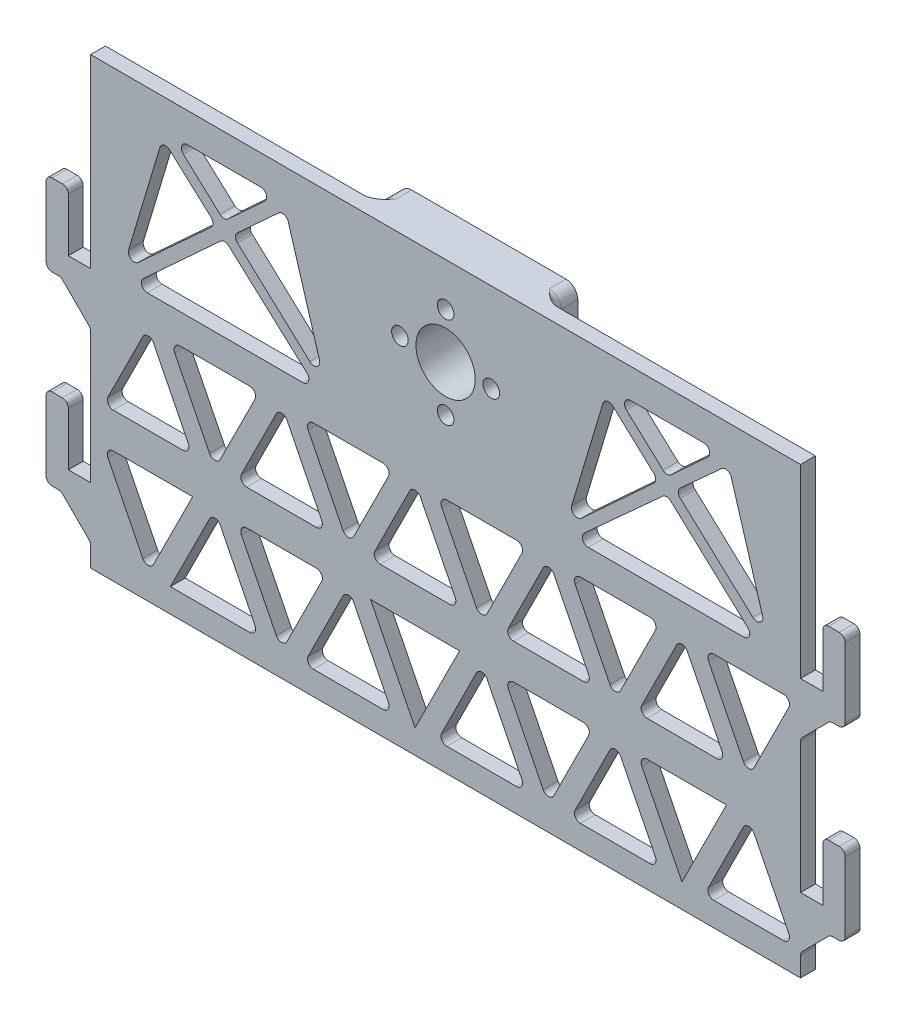
from build123d import *

# Parameters (mm, degrees)
SKETCH1_W            = 38.1
SKETCH1_H            = 38.1
BOSS_EXTRUDE1_DEPTH  = 9.2583
SKETCH2_R            = 6.35
CUT_EXTRUDE1_DEPTH   = 10.8458
SKETCH3_R            = 1.778
CUT_EXTRUDE2_DEPTH   = 10.8458
CIRPATTERN1_COUNT    = 4
SKETCH4_W            = 56.957976
SKETCH4_H            = 95.2246
BOSS_EXTRUDE2_DEPTH  = 3.175
SKETCH5_W            = 38.1
SKETCH5_H            = 57.1246
BOSS_EXTRUDE3_DEPTH  = 3.175
FILLET1_R            = 2.54
FILLET2_R            = 2.54
BOSS_EXTRUDE4_DEPTH  = 3.175
BOSS_EXTRUDE5_DEPTH  = 3.175
CHAMFER1_SIZE        = 6.35
FILLET3_R            = 1.27
CHAMFER2_SIZE        = 6.35
FILLET4_R            = 1.27
CUT_EXTRUDE3_DEPTH   = 4.7625
BOSS_EXTRUDE6_DEPTH  = 3.175
BOSS_EXTRUDE7_DEPTH  = 3.175
FILLET5_R            = 1.27
FILLET6_R            = 1.27
CUT_EXTRUDE4_DEPTH   = 3.175
LPATTERN1_COUNT      = 5
LPATTERN1_PITCH      = 28.575
MIRROR5_COPY_1_DEPTH = 3.175
MIRROR5_COPY_2_DEPTH = 3.175
MIRROR5_COPY_3_DEPTH = 3.175
MIRROR5_COPY_4_DEPTH = 3.175
FILLET7_R            = 1.27


with BuildPart() as part:
    # Sketch1 → Boss-Extrude1 (new body)
    with BuildSketch(Plane.XY):
        with Locations((-19.05, -19.05)):
            Rectangle(SKETCH1_W, SKETCH1_H)
    extrude(amount=BOSS_EXTRUDE1_DEPTH)

    # Sketch2 → Cut-Extrude1 (cut)
    with BuildSketch(Plane.XY.offset(9.2583)):
        with Locations((-19.05, -19.05)):
            Circle(SKETCH2_R)
    extrude(amount=-CUT_EXTRUDE1_DEPTH, mode=Mode.SUBTRACT)

    # Sketch3 → Cut-Extrude2 (cut)
    with BuildSketch(Plane.XY.offset(9.2583)):
        with Locations((-19.05, -9.271)):
            Circle(SKETCH3_R)
    cut_extrude2 = extrude(amount=-CUT_EXTRUDE2_DEPTH, mode=Mode.SUBTRACT)

    # CirPattern1: Cut-Extrude2 ×4 about axis
    cirpattern1_axis = Axis((-19.05, -19.05, 0), (0, 0, 1))
    for i in range(1, CIRPATTERN1_COUNT):
        add(cut_extrude2.rotate(cirpattern1_axis, i * 360 / CIRPATTERN1_COUNT), mode=Mode.SUBTRACT)

    # Sketch4 → Boss-Extrude2 (add)
    with BuildSketch(Plane.XY.offset(9.2583)):
        with Locations((-66.578988, -47.6123)):
            Rectangle(SKETCH4_W, SKETCH4_H)
        with Locations((28.478988, -47.6123)):
            Rectangle(SKETCH4_W, SKETCH4_H)
    extrude(amount=-BOSS_EXTRUDE2_DEPTH)

    # Sketch5 → Boss-Extrude3 (add)
    with BuildSketch(Plane(origin=(0, 0, 6.0833), x_dir=(-1, 0, 0), z_dir=(0, 0, -1))):
        with Locations((19.05, -66.6623)):
            Rectangle(SKETCH5_W, SKETCH5_H)
    extrude(amount=-BOSS_EXTRUDE3_DEPTH)

    # Fillet1
    fillet1_edges = [part.edges().sort_by_distance(p)[0] for p in [
        (-38.1, -38.1, 3.04165),
        (-38.1, 0, 3.04165),
        (0, 0, 3.04165),
        (0, -38.1, 3.04165),
    ]]
    fillet(fillet1_edges, radius=FILLET1_R)

    # Fillet2
    # the kernel refuses this fillet: 2.54 mm, written as the material it adds along each edge
    with BuildSketch(Plane(origin=(-38.1, -35.56, 6.0833), x_dir=(0, 0, -1), z_dir=(0, 1, 0)), Plane(origin=(-2.54, -38.1, 6.0833), x_dir=(0, 0, -1), z_dir=(-1, 0, 0))) as fillet2_piece_1:
        with BuildLine():
            CenterArc((FILLET2_R, FILLET2_R), FILLET2_R, 180, 90)
            Line((0, FILLET2_R), (0, 0))
            Line((0, 0), (FILLET2_R, 0))
        make_face()
    extrude(amount=33.02)
    with BuildSketch(Plane(origin=(0, -35.56, 6.0833), x_dir=(0, 0, -1), z_dir=(0, 1, 0))) as fillet2_piece_2:
        with BuildLine():
            CenterArc((FILLET2_R, -FILLET2_R), FILLET2_R, 90, 90)
            Line((0, -FILLET2_R), (0, 0))
            Line((0, 0), (FILLET2_R, 0))
        make_face()
    extrude(amount=33.02)
    with BuildSketch(Plane(origin=(-35.56, -2.54, 6.0833), x_dir=(0.5976672776328278, -0.8017442392976482, 0), z_dir=(-0.8017442392976482, -0.5976672776328278, 0))) as fillet2_piece_3_section:
        with BuildLine():
            CenterArc((2.54 + FILLET2_R, -FILLET2_R), FILLET2_R, 90, 90)
            Line((2.54 + FILLET2_R, 0), (2.54, 0))
            Line((2.54, 0), (2.54, -FILLET2_R))
        make_face()
    fillet2_piece_3 = revolve(axis=Axis((-35.56, -2.54, 6.0833), (0, 0, 1)), revolution_arc=233.296989237, mode=Mode.PRIVATE)
    fillet2_piece_3 = split(fillet2_piece_3, bisect_by=Plane(origin=(-37.464844957, 0, 5.291764105), z_dir=(0, -1, 0)), keep=Keep.TOP, mode=Mode.PRIVATE)
    add(fillet2_piece_3)
    with BuildSketch(Plane(origin=(-35.56, -35.56, 6.0833), x_dir=(0, -1, 0), z_dir=(1, 0, 0))) as fillet2_piece_4:
        with BuildLine():
            CenterArc((2.54 + FILLET2_R, FILLET2_R), FILLET2_R, 180, 90)
            Line((2.54 + FILLET2_R, 0), (2.54, 0))
            Line((2.54, 0), (2.54, FILLET2_R))
        make_face()
    revolve(axis=Axis((-35.56, -35.56, 6.0833), (0, 0, -1)), revolution_arc=90)
    with BuildSketch(Plane(origin=(-2.54, -35.56, 6.0833), x_dir=(0, -1, 0), z_dir=(-1, 0, 0))) as fillet2_piece_5:
        with BuildLine():
            CenterArc((2.54 + FILLET2_R, -FILLET2_R), FILLET2_R, 90, 90)
            Line((2.54 + FILLET2_R, 0), (2.54, 0))
            Line((2.54, 0), (2.54, -FILLET2_R))
        make_face()
    revolve(axis=Axis((-2.54, -35.56, 6.0833), (0, 0, 1)), revolution_arc=90)
    with BuildSketch(Plane(origin=(-2.54, -2.54, 6.0833), x_dir=(-0.5976672776328269, -0.8017442392976487, 0), z_dir=(0.8017442392976487, -0.5976672776328269, 0))) as fillet2_piece_6_section:
        with BuildLine():
            CenterArc((2.54 + FILLET2_R, FILLET2_R), FILLET2_R, 180, 90)
            Line((2.54, FILLET2_R), (2.54, 0))
            Line((2.54, 0), (2.54 + FILLET2_R, 0))
        make_face()
    fillet2_piece_6 = revolve(axis=Axis((-2.54, -2.54, 6.0833), (0, 0, -1)), revolution_arc=233.296989237, mode=Mode.PRIVATE)
    fillet2_piece_6 = split(fillet2_piece_6, bisect_by=Plane(origin=(-0.63515521, 0, 5.291763812), z_dir=(0, -1, 0)), keep=Keep.TOP, mode=Mode.PRIVATE)
    add(fillet2_piece_6)

    # Sketch6 → Boss-Extrude4 (add)
    with BuildSketch(Plane(origin=(0, 0, 6.0833), x_dir=(-1, 0, 0), z_dir=(0, 0, -1))):
        Polygon((-56.957976, -39.6875), (-61.720476, -39.6875), (-61.720476, -26.9875), (-66.482976, -26.9875), (-66.482976, -44.45), (-56.957976, -44.45), align=None)
    boss_extrude4 = extrude(amount=-BOSS_EXTRUDE4_DEPTH)

    # Sketch7 → Boss-Extrude5 (add)
    with BuildSketch(Plane(origin=(0, 0, 6.0833), x_dir=(-1, 0, 0), z_dir=(0, 0, -1))):
        Polygon((-56.957976, -84.1375), (-66.482976, -84.1375), (-66.482976, -66.675), (-61.720476, -66.675), (-61.720476, -79.375), (-56.957976, -79.375), align=None)
    boss_extrude5 = extrude(amount=-BOSS_EXTRUDE5_DEPTH)

    # Chamfer1
    chamfer1_edges = [part.edges().sort_by_distance(p)[0] for p in [
        (56.957976, -44.45, 7.6708),
        (56.957976, -84.1375, 7.6708),
    ]]
    chamfer(chamfer1_edges, length=CHAMFER1_SIZE)

    # Fillet3
    fillet3_edges = [part.edges().sort_by_distance(p)[0] for p in [
        (66.482976, -44.45, 7.6708),
        (66.482976, -26.9875, 7.6708),
        (61.720476, -26.9875, 7.6708),
        (66.482976, -84.1375, 7.6708),
        (66.482976, -66.675, 7.6708),
        (61.720476, -66.675, 7.6708),
        (63.307976, -84.1375, 7.6708),
        (56.957976, -90.4875, 7.6708),
        (63.307976, -44.45, 7.6708),
        (56.957976, -50.8, 7.6708),
    ]]
    fillet(fillet3_edges, radius=FILLET3_R)

    # Mirror2: Boss-Extrude4, Boss-Extrude5 across plane
    add(boss_extrude4.mirror(Plane(origin=(-19.05, 0, 0), x_dir=(0, 0, 1), z_dir=(1, 0, 0))))
    add(boss_extrude5.mirror(Plane(origin=(-19.05, 0, 0), x_dir=(0, 0, 1), z_dir=(1, 0, 0))))

    # Chamfer2
    chamfer2_edges = [part.edges().sort_by_distance(p)[0] for p in [
        (-95.057976, -44.45, 7.6708),
        (-95.057976, -84.1375, 7.6708),
    ]]
    chamfer(chamfer2_edges, length=CHAMFER2_SIZE)

    # Fillet4
    fillet4_edges = [part.edges().sort_by_distance(p)[0] for p in [
        (-99.820476, -26.9875, 7.6708),
        (-104.582976, -26.9875, 7.6708),
        (-104.582976, -44.45, 7.6708),
        (-99.820476, -66.675, 7.6708),
        (-104.582976, -66.675, 7.6708),
        (-104.582976, -84.1375, 7.6708),
        (-95.057976, -50.8, 7.6708),
        (-101.407976, -44.45, 7.6708),
        (-95.057976, -90.4875, 7.6708),
        (-101.407976, -84.1375, 7.6708),
    ]]
    fillet(fillet4_edges, radius=FILLET4_R)

    # Sketch8 → Cut-Extrude3 (cut)
    with BuildSketch(Plane(origin=(0, 0, 6.0833), x_dir=(-1, 0, 0), z_dir=(0, 0, -1))):
        Polygon((-50.607976, -38.1), (-6.157976, -38.1), (-15.682976, -6.35), (-41.082976, -6.35), align=None)
    cut_extrude3 = extrude(amount=-CUT_EXTRUDE3_DEPTH, mode=Mode.SUBTRACT)

    # Mirror3: Cut-Extrude3 across plane
    add(cut_extrude3.mirror(Plane(origin=(-19.05, 0, 0), x_dir=(0, 0, 1), z_dir=(1, 0, 0))), mode=Mode.SUBTRACT)

    # Sketch9 → Boss-Extrude6 (add)
    with BuildSketch(Plane(origin=(0, 0, 6.0833), x_dir=(-1, 0, 0), z_dir=(0, 0, -1))):
        Polygon((-41.539140768, -7.870549228), (-8.189976, -38.1), (-6.157976, -38.1), (-6.614140768, -36.579450772), (-39.495476, -6.35), (-41.082976, -6.35), align=None)
    boss_extrude6 = extrude(amount=-BOSS_EXTRUDE6_DEPTH)

    # Sketch10 → Boss-Extrude7 (add)
    with BuildSketch(Plane(origin=(0, 0, 6.0833), x_dir=(-1, 0, 0), z_dir=(0, 0, -1))):
        Polygon((-50.607976, -38.1), (-48.067976, -38.1), (-15.226811232, -7.870549228), (-15.682976, -6.35), (-17.270476, -6.35), (-50.151811232, -36.579450772), align=None)
    boss_extrude7 = extrude(amount=-BOSS_EXTRUDE7_DEPTH)

    # Mirror4: Boss-Extrude6, Boss-Extrude7 across plane
    add(boss_extrude6.mirror(Plane(origin=(-19.05, 0, 0), x_dir=(0, 0, 1), z_dir=(1, 0, 0))))
    add(boss_extrude7.mirror(Plane(origin=(-19.05, 0, 0), x_dir=(0, 0, 1), z_dir=(1, 0, 0))))

    # Fillet5
    fillet5_edges = [part.edges().sort_by_distance(p)[0] for p in [
        (41.539140768, -7.870549228, 7.6708),
        (39.495476, -6.35, 7.6708),
        (6.614140768, -36.579450772, 7.6708),
        (8.189976, -38.1, 7.6708),
        (28.282004578, -19.887520226, 7.6708),
        (30.151906906, -18.192541634, 7.6708),
        (28.382976, -16.566275262, 7.6708),
        (26.527262553, -18.27232515, 7.6708),
        (15.226811232, -7.870549228, 7.6708),
        (50.151811232, -36.579450772, 7.6708),
        (17.270476, -6.35, 7.6708),
        (48.067976, -38.1, 7.6708),
    ]]
    fillet(fillet5_edges, radius=FILLET5_R)

    # Fillet6
    fillet6_edges = [part.edges().sort_by_distance(p)[0] for p in [
        (-79.639140768, -7.870549228, 7.6708),
        (-46.289976, -38.1, 7.6708),
        (-44.714140768, -36.579450772, 7.6708),
        (-77.595476, -6.35, 7.6708),
        (-66.482976, -16.566275262, 7.6708),
        (-64.627262553, -18.27232515, 7.6708),
        (-66.382004578, -19.887520226, 7.6708),
        (-86.167976, -38.1, 7.6708),
        (-68.251906906, -18.192541634, 7.6708),
        (-55.370476, -6.35, 7.6708),
        (-88.251811232, -36.579450772, 7.6708),
        (-53.326811232, -7.870549228, 7.6708),
    ]]
    fillet(fillet6_edges, radius=FILLET6_R)

    # Sketch11 → Cut-Extrude4 (cut)
    with BuildSketch(Plane(origin=(0, 0, 6.0833), x_dir=(-1, 0, 0), z_dir=(0, 0, -1))):
        Polygon((-55.370476, -44.45), (-36.320476, -44.45), (-45.845476, -63.5), align=None)
        Polygon((-41.082976, -63.5), (-31.557976, -44.45), (-22.032976, -63.5), align=None)
    cut_extrude4 = extrude(amount=-CUT_EXTRUDE4_DEPTH, mode=Mode.SUBTRACT)

    # LPattern1: Cut-Extrude4 ×5
    with Locations(*[(-i * LPATTERN1_PITCH, 0, 0) for i in range(1, LPATTERN1_COUNT)]):
        add(cut_extrude4, mode=Mode.SUBTRACT)

    # Mirror5: Cut-Extrude4 across plane
    add(cut_extrude4.mirror(Plane(origin=(0, -67.2846, 0), x_dir=(0, 0, 1), z_dir=(0, -1, 0))), mode=Mode.SUBTRACT)

    # Mirror5 copy 1 sketch → Mirror5 copy 1 (cut)
    with BuildSketch(Plane(origin=(-28.575, -134.5692, 6.0833), x_dir=(-1, 0, 0), z_dir=(0, 0, -1))):
        Polygon((-55.370476, 44.45), (-36.320476, 44.45), (-45.845476, 63.5), align=None)
        Polygon((-41.082976, 63.5), (-31.557976, 44.45), (-22.032976, 63.5), align=None)
    extrude(amount=-MIRROR5_COPY_1_DEPTH, mode=Mode.SUBTRACT)

    # Mirror5 copy 2 sketch → Mirror5 copy 2 (cut)
    with BuildSketch(Plane(origin=(-57.15, -134.5692, 6.0833), x_dir=(-1, 0, 0), z_dir=(0, 0, -1))):
        Polygon((-55.370476, 44.45), (-36.320476, 44.45), (-45.845476, 63.5), align=None)
        Polygon((-41.082976, 63.5), (-31.557976, 44.45), (-22.032976, 63.5), align=None)
    extrude(amount=-MIRROR5_COPY_2_DEPTH, mode=Mode.SUBTRACT)

    # Mirror5 copy 3 sketch → Mirror5 copy 3 (cut)
    with BuildSketch(Plane(origin=(-85.725, -134.5692, 6.0833), x_dir=(-1, 0, 0), z_dir=(0, 0, -1))):
        Polygon((-55.370476, 44.45), (-36.320476, 44.45), (-45.845476, 63.5), align=None)
        Polygon((-41.082976, 63.5), (-31.557976, 44.45), (-22.032976, 63.5), align=None)
    extrude(amount=-MIRROR5_COPY_3_DEPTH, mode=Mode.SUBTRACT)

    # Mirror5 copy 4 sketch → Mirror5 copy 4 (cut)
    with BuildSketch(Plane(origin=(-114.3, -134.5692, 6.0833), x_dir=(-1, 0, 0), z_dir=(0, 0, -1))):
        Polygon((-55.370476, 44.45), (-36.320476, 44.45), (-45.845476, 63.5), align=None)
        Polygon((-41.082976, 63.5), (-31.557976, 44.45), (-22.032976, 63.5), align=None)
    extrude(amount=-MIRROR5_COPY_4_DEPTH, mode=Mode.SUBTRACT)

    # Fillet7
    fillet7_edges = [part.edges().sort_by_distance(p)[0] for p in [
        (-58.929524, -90.1192, 7.6708),
        (-68.454524, -71.0692, 7.6708),
        (-44.642024, -71.0692, 7.6708),
        (-63.692024, -71.0692, 7.6708),
        (-54.167024, -90.1192, 7.6708),
        (26.795476, -90.1192, 7.6708),
        (17.270476, -71.0692, 7.6708),
        (7.745476, -90.1192, 7.6708),
        (22.032976, -71.0692, 7.6708),
        (-1.779524, -90.1192, 7.6708),
        (-11.304524, -71.0692, 7.6708),
        (-20.829524, -90.1192, 7.6708),
        (12.507976, -71.0692, 7.6708),
        (-6.542024, -71.0692, 7.6708),
        (2.982976, -90.1192, 7.6708),
        (-92.267024, -71.0692, 7.6708),
        (-82.742024, -90.1192, 7.6708),
        (55.370476, -90.1192, 7.6708),
        (45.845476, -71.0692, 7.6708),
        (36.320476, -90.1192, 7.6708),
        (22.032976, -63.5, 7.6708),
        (41.082976, -63.5, 7.6708),
        (31.557976, -44.45, 7.6708),
        (45.845476, -63.5, 7.6708),
        (55.370476, -44.45, 7.6708),
        (36.320476, -44.45, 7.6708),
        (-6.542024, -63.5, 7.6708),
        (12.507976, -63.5, 7.6708),
        (2.982976, -44.45, 7.6708),
        (-35.117024, -63.5, 7.6708),
        (-16.067024, -63.5, 7.6708),
        (-25.592024, -44.45, 7.6708),
        (-63.692024, -63.5, 7.6708),
        (-44.642024, -63.5, 7.6708),
        (-54.167024, -44.45, 7.6708),
        (-92.267024, -63.5, 7.6708),
        (-73.217024, -63.5, 7.6708),
        (-82.742024, -44.45, 7.6708),
        (17.270476, -63.5, 7.6708),
        (26.795476, -44.45, 7.6708),
        (7.745476, -44.45, 7.6708),
        (-11.304524, -63.5, 7.6708),
        (-1.779524, -44.45, 7.6708),
        (-20.829524, -44.45, 7.6708),
        (-39.879524, -63.5, 7.6708),
        (-30.354524, -44.45, 7.6708),
        (-49.404524, -44.45, 7.6708),
        (-68.454524, -63.5, 7.6708),
        (-58.929524, -44.45, 7.6708),
        (-77.979524, -44.45, 7.6708),
        (-30.354524, -90.1192, 7.6708),
        (-39.879524, -71.0692, 7.6708),
        (-49.404524, -90.1192, 7.6708),
    ]]
    fillet(fillet7_edges, radius=FILLET7_R)


solid = part.part
